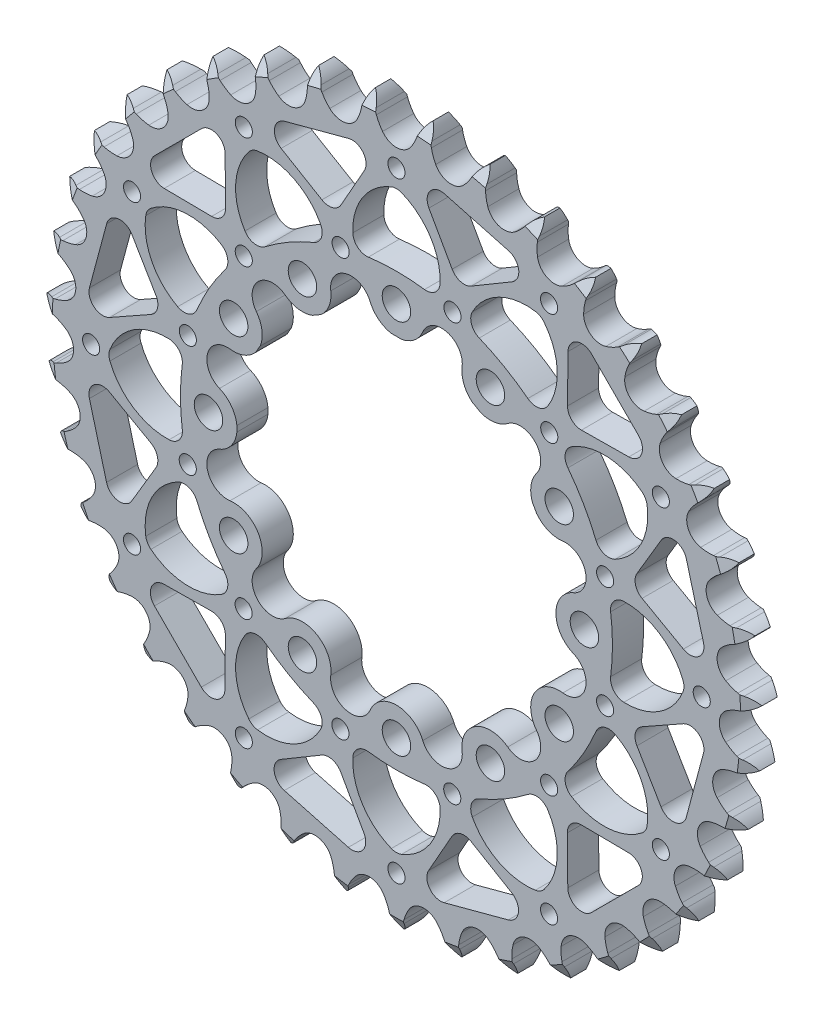
from build123d import *

# Parameters (mm, degrees)
EXTRUSION_DEPTH          = 7.2136
CIRPATTERN1_COUNT        = 12
CUT_EXTRUDE1_DEPTH       = 118.514389318
CUT_EXTRUDE1_DEPTH_BACK  = 118.514389318
SKETCH8_R                = 37
CENTER_CUTOUT_DEPTH      = 118.514389465
CENTER_CUTOUT_DEPTH_BACK = 118.514389465
SKETCH10_R               = 1.984375
CUT_EXTRUDE2_DEPTH       = 118.514389465


with BuildPart() as part:
    # Teeth Sketch → Extrusion (new body)
    with BuildSketch(Plane.XY):
        with BuildLine():
            ThreePointArc((6.676484762, 82.703103732), (5.710873677, 81.555589606), (5.037571935, 80.215493266))
            Line((5.037571935, 80.215493266), (4.65053543, 79.150636707))
            ThreePointArc((4.65053543, 79.150636707), (4.030589042, 77.787636082), (3.22092759, 76.5280518))
            ThreePointArc((3.22092759, 76.5280518), (0, 74.905926143), (-3.22092759, 76.5280518))
            ThreePointArc((-3.22092759, 76.5280518), (-4.030589042, 77.787636082), (-4.65053543, 79.150636707))
            Line((-4.65053543, 79.150636707), (-5.037571935, 80.215493266))
            ThreePointArc((-5.037571935, 80.215493266), (-5.710873677, 81.555589606), (-6.676484762, 82.703103732))
            ThreePointArc((-6.676484762, 82.703103732), (-7.445517227, 81.415554702), (-7.895133318, 79.984807062))
            Line((-7.895133318, 79.984807062), (-8.106342797, 78.871655094))
            ThreePointArc((-8.106342797, 78.871655094), (-8.499620367, 77.426858575), (-9.096745387, 76.053706749))
            ThreePointArc((-9.096745387, 76.053706749), (-12.015755556, 73.935914073), (-15.455180235, 75.020360508))
            ThreePointArc((-15.455180235, 75.020360508), (-16.456408311, 76.133754674), (-17.286967233, 77.379658404))
            Line((-17.286967233, 77.379658404), (-17.83980672, 78.368640329))
            ThreePointArc((-17.83980672, 78.368640329), (-18.719355953, 79.583377579), (-19.856536839, 80.561136787))
            ThreePointArc((-19.856536839, 80.561136787), (-20.409073146, 79.166899696), (-20.623358765, 77.682556369))
            Line((-20.623358765, 77.682556369), (-20.653271004, 76.549939044))
            ThreePointArc((-20.653271004, 76.549939044), (-20.809694072, 75.060766102), (-21.178817437, 73.609610642))
            ThreePointArc((-21.178817437, 73.609610642), (-23.720309356, 71.051000665), (-27.289151829, 71.569681286))
            ThreePointArc((-27.289151829, 71.569681286), (-28.456015249, 72.508049011), (-29.475675664, 73.604587595))
            Line((-29.475675664, 73.604587595), (-30.179999883, 74.492080773))
            ThreePointArc((-30.179999883, 74.492080773), (-31.243016742, 75.549997876), (-32.522315041, 76.332678717))
            ThreePointArc((-32.522315041, 76.332678717), (-32.844044791, 74.867863573), (-32.817450053, 73.368368272))
            Line((-32.817450053, 73.368368272), (-32.66529034, 72.245619783))
            ThreePointArc((-32.66529034, 72.245619783), (-32.580807632, 70.750639215), (-32.71236924, 69.259064285))
            ThreePointArc((-32.71236924, 69.259064285), (-34.810519602, 66.325903661), (-38.416348726, 66.265384911))
            ThreePointArc((-38.416348726, 66.265384911), (-39.71862634, 67.004422965), (-40.900979579, 67.923196629))
            Line((-40.900979579, 67.923196629), (-41.738546902, 68.686215454))
            ThreePointArc((-41.738546902, 68.686215454), (-42.957499809, 69.559912912), (-44.345782367, 70.127244363))
            ThreePointArc((-44.345782367, 70.127244363), (-44.428372928, 68.629789109), (-44.161586623, 67.153977974))
            Line((-44.161586623, 67.153977974), (-43.831295815, 66.070176918))
            ThreePointArc((-43.831295815, 66.070176918), (-43.508095388, 64.608107935), (-43.398687863, 63.114744543))
            ThreePointArc((-43.398687863, 63.114744543), (-44.999155676, 59.883000591), (-48.54858237, 59.244849876))
            ThreePointArc((-48.54858237, 59.244849876), (-49.952545871, 59.765417561), (-51.266969607, 60.48263055))
            Line((-51.266969607, 60.48263055), (-52.21608748, 61.101413234))
            ThreePointArc((-52.21608748, 61.101413234), (-53.559406195, 61.768262742), (-55.020717224, 62.105551216))
            ThreePointArc((-55.020717224, 62.105551216), (-54.862029543, 60.614239157), (-54.361961296, 59.200334922))
            Line((-54.361961296, 59.200334922), (-53.862093752, 58.183551176))
            ThreePointArc((-53.862093752, 58.183551176), (-53.308546327, 56.792260597), (-52.961003266, 55.335786069))
            ThreePointArc((-52.961003266, 55.335786069), (-54.022337255, 51.889159262), (-57.423433231, 50.689904348))
            ThreePointArc((-57.423433231, 50.689904348), (-58.892720703, 50.978519235), (-60.305172051, 51.475596109))
            Line((-60.305172051, 51.475596109), (-61.34125882, 51.934116506))
            ThreePointArc((-61.34125882, 51.934116506), (-62.774152094, 52.376847013), (-64.270644405, 52.475356916))
            ThreePointArc((-64.270644405, 52.475356916), (-63.87478841, 51.02881225), (-63.154389727, 49.713434291))
            Line((-63.154389727, 49.713434291), (-62.497891753, 48.790002021))
            ThreePointArc((-62.497891753, 48.790002021), (-61.728333918, 47.505523541), (-61.151656504, 46.123659804))
            ThreePointArc((-61.151656504, 46.123659804), (-61.646368676, 42.551415963), (-64.811047336, 40.822116924))
            ThreePointArc((-64.811047336, 40.822116924), (-66.307605004, 40.871304038), (-67.781502216, 41.135370767))
            Line((-67.781502216, 41.135370767), (-68.877723777, 41.42175344))
            ThreePointArc((-68.877723777, 41.42175344), (-70.363080428, 41.628898458), (-71.855995657, 41.486078435))
            ThreePointArc((-71.855995657, 41.486078435), (-71.23322381, 40.12176591), (-70.311152637, 38.938981826))
            Line((-70.311152637, 38.938981826), (-69.515027187, 38.132817442))
            ThreePointArc((-69.515027187, 38.132817442), (-68.549390085, 36.988418379), (-67.75851396, 35.716954977))
            ThreePointArc((-67.75851396, 35.716954977), (-67.673791529, 32.111613343), (-70.520089358, 29.897058114))
            ThreePointArc((-70.520089358, 29.897058114), (-72.005157166, 29.705543536), (-73.502327078, 29.729760931))
            Line((-73.502327078, 29.729760931), (-74.630291869, 29.836588719))
            ThreePointArc((-74.630291869, 29.836588719), (-76.129641939, 29.8027833), (-77.580314364, 29.422332315))
            ThreePointArc((-77.580314364, 29.422332315), (-76.74675613, 28.175586908), (-75.646893627, 27.156030185))
            Line((-75.646893627, 27.156030185), (-74.731759931, 26.488012922))
            ThreePointArc((-74.731759931, 26.488012922), (-73.595053056, 25.51333261), (-72.610461496, 24.385199777))
            ThreePointArc((-72.610461496, 24.385199777), (-71.948498729, 20.840136804), (-74.402698108, 18.197681204))
            ThreePointArc((-74.402698108, 18.197681204), (-75.837813579, 17.77042506), (-77.319480277, 17.554165902))
            Line((-77.319480277, 17.554165902), (-78.449974603, 17.478672021))
            ThreePointArc((-78.449974603, 17.478672021), (-79.924485713, 17.204791709), (-81.295343681, 16.596563242))
            ThreePointArc((-81.295343681, 16.596563242), (-80.27258778, 15.499675005), (-79.023419807, 14.669751627))
            Line((-79.023419807, 14.669751627), (-78.012979347, 14.15718278))
            ThreePointArc((-78.012979347, 14.15718278), (-76.734642811, 13.377464928), (-75.58183622, 12.421880712))
            ThreePointArc((-75.58183622, 12.421880712), (-74.359777605, 9.028911669), (-76.358316059, 6.026993909))
            ThreePointArc((-76.358316059, 6.026993909), (-77.706310456, 5.375061909), (-79.134099551, 4.923927198))
            Line((-79.134099551, 4.923927198), (-80.237844202, 4.6680669))
            ThreePointArc((-80.237844202, 4.6680669), (-81.649327289, 4.161205049), (-82.904866299, 3.340951899))
            ThreePointArc((-82.904866299, 3.340951899), (-81.719401571, 2.422329661), (-80.353280924, 1.803534207))
            Line((-80.353280924, 1.803534207), (-79.273703577, 1.45968904))
            ThreePointArc((-79.273703577, 1.45968904), (-77.886845624, 0.895127931), (-76.595681088, 0.136841462))
            ThreePointArc((-76.595681088, 0.136841462), (-74.8451773, -3.016157536), (-76.336293733, -6.299789363))
            ThreePointArc((-76.336293733, -6.299789363), (-77.56225471, -7.159512522), (-78.899187214, -7.833838635))
            Line((-78.899187214, -7.833838635), (-79.947595784, -8.263438702))
            ThreePointArc((-79.947595784, -8.263438702), (-81.259494176, -8.990154635), (-82.367196428, -10.001188343))
            ThreePointArc((-82.367196428, -10.001188343), (-81.049725787, -10.717752749), (-79.602034272, -11.109393802))
            Line((-79.602034272, -11.109393802), (-78.481280524, -11.275609878))
            ThreePointArc((-78.481280524, -11.275609878), (-77.021820047, -11.610392409), (-75.625738049, -12.151741911))
            ThreePointArc((-75.625738049, -12.151741911), (-73.392126218, -14.983109845), (-74.337201497, -18.463411399))
            ThreePointArc((-74.337201497, -18.463411399), (-75.409377308, -19.50865934), (-76.620827372, -20.388712162))
            Line((-76.620827372, -20.388712162), (-77.586746629, -20.980925582))
            ThreePointArc((-77.586746629, -20.980925582), (-78.765082849, -21.908674036), (-79.696259435, -23.08430306))
            ThreePointArc((-79.696259435, -23.08430306), (-78.280904679, -23.580250992), (-76.789136745, -23.734594346))
            Line((-76.789136745, -23.734594346), (-75.656233531, -23.718876424))
            ThreePointArc((-75.656233531, -23.718876424), (-74.161969788, -23.815209685), (-72.697128119, -24.125601551))
            ThreePointArc((-72.697128119, -24.125601551), (-70.038257617, -26.562007479), (-70.41281479, -30.148840778))
            ThreePointArc((-70.41281479, -30.148840778), (-71.303436645, -31.352542128), (-72.358028349, -32.415528753))
            Line((-72.358028349, -32.415528753), (-73.216441492, -33.155017511))
            ThreePointArc((-73.216441492, -33.155017511), (-74.230697248, -34.259770288), (-74.961231185, -35.569546454))
            ThreePointArc((-74.961231185, -35.569546454), (-73.484649258, -35.832033121), (-71.987440912, -35.745081364))
            Line((-71.987440912, -35.745081364), (-70.871729829, -35.547836529))
            ThreePointArc((-70.871729829, -35.547836529), (-69.381363468, -35.403225539), (-67.885700756, -35.474620783))
            ThreePointArc((-67.885700756, -35.474620783), (-64.870434934, -37.452963072), (-64.664773166, -41.053431017))
            ThreePointArc((-64.664773166, -41.053431017), (-65.350774426, -42.384410543), (-66.221194398, -43.602800177))
            Line((-66.221194398, -43.602800177), (-66.949868978, -44.470411902))
            ThreePointArc((-66.949868978, -44.470411902), (-67.773775581, -45.723556485), (-68.284746423, -47.133557278))
            ThreePointArc((-68.284746423, -47.133557278), (-66.785180021, -47.155784414), (-65.321308173, -46.829789551))
            Line((-65.321308173, -46.829789551), (-64.251685552, -46.456126341))
            ThreePointArc((-64.251685552, -46.456126341), (-62.803816278, -46.074316448), (-61.316069403, -45.904865971))
            ThreePointArc((-61.316069403, -45.904865971), (-58.022502061, -47.373906594), (-57.241947884, -50.894758957))
            ThreePointArc((-57.241947884, -50.894758957), (-57.705561477, -52.318544989), (-58.369266298, -53.66078198))
            Line((-58.369266298, -53.66078198), (-58.949330025, -54.634045983))
            ThreePointArc((-58.949330025, -54.634045983), (-59.561548726, -56.003126587), (-59.839722596, -57.476833727))
            ThreePointArc((-59.839722596, -57.476833727), (-58.356009703, -57.25822566), (-56.963387864, -56.701630787))
            Line((-56.963387864, -56.701630787), (-55.967556369, -56.161226883))
            ThreePointArc((-55.967556369, -56.161226883), (-54.599683236, -55.552106762), (-53.15838406, -55.146199243))
            ThreePointArc((-53.15838406, -55.146199243), (-49.671816862, -56.06789082), (-48.336586219, -59.417939375))
            ThreePointArc((-48.336586219, -59.417939375), (-48.565804798, -60.897656602), (-49.00560486, -62.328977716))
            Line((-49.00560486, -62.328977716), (-49.422034389, -63.382686971))
            ThreePointArc((-49.422034389, -63.382686971), (-49.806709045, -64.832245127), (-49.844881387, -66.331490374))
            ThreePointArc((-49.844881387, -66.331490374), (-48.415449386, -65.877708938), (-47.130145731, -65.104929569))
            Line((-47.130145731, -65.104929569), (-46.233896874, -64.411781148))
            ThreePointArc((-46.233896874, -64.411781148), (-44.981447078, -63.591126692), (-43.623924493, -62.959274922))
            ThreePointArc((-43.623924493, -62.959274922), (-40.034657698, -63.309746125), (-38.179332362, -66.402226373))
            ThreePointArc((-38.179332362, -66.402226373), (-38.168219284, -67.899550896), (-38.372723998, -69.38288567))
            Line((-38.372723998, -69.38288567), (-38.614734022, -70.489749661))
            ThreePointArc((-38.614734022, -70.489749661), (-38.761901763, -71.982242573), (-38.559083932, -73.468196262))
            ThreePointArc((-38.559083932, -73.468196262), (-37.220954361, -72.790994159), (-36.076257579, -71.822044874))
            Line((-36.076257579, -71.822044874), (-35.302803736, -70.994104116))
            ThreePointArc((-35.302803736, -70.994104116), (-34.198215068, -69.983169844), (-32.959628196, -69.141738451))
            ThreePointArc((-32.959628196, -69.141738451), (-29.360621929, -68.91191226), (-27.033253851, -71.666730588))
            ThreePointArc((-27.033253851, -71.666730588), (-26.78209694, -73.142882488), (-26.74600974, -74.639813329))
            Line((-26.74600974, -74.639813329), (-26.807332328, -75.77116486))
            ThreePointArc((-26.807332328, -75.77116486), (-26.713181585, -77.267937748), (-26.274626458, -78.702114459))
            ThreePointArc((-26.274626458, -78.702114459), (-25.06245617, -77.819030866), (-24.088013307, -76.679006943))
            Line((-24.088013307, -76.679006943), (-23.457386525, -75.737717079))
            ThreePointArc((-23.457386525, -75.737717079), (-22.529267252, -74.562685657), (-21.441694841, -73.533467273))
            ThreePointArc((-21.441694841, -73.533467273), (-17.926161474, -72.729296065), (-15.187028265, -75.075104125))
            ThreePointArc((-15.187028265, -75.075104125), (-14.702332353, -76.491851845), (-14.426587879, -77.96360903))
            Line((-14.426587879, -77.96360903), (-14.305634807, -79.090146691))
            ThreePointArc((-14.305634807, -79.090146691), (-13.972604036, -80.552433921), (-13.309669959, -81.897689231))
            ThreePointArc((-13.309669959, -81.897689231), (-12.254853529, -80.83159555), (-11.475902142, -79.55002301))
            Line((-11.475902142, -79.55002301), (-11.004435324, -78.519762952))
            ThreePointArc((-11.004435324, -78.519762952), (-10.276823247, -77.211067077), (-9.368432854, -76.020717918))
            ThreePointArc((-9.368432854, -76.020717918), (-6.027422853, -74.663029306), (-2.947466624, -76.5390719))
            ThreePointArc((-2.947466624, -76.5390719), (-2.241785081, -77.859722417), (-1.733524971, -79.26818821))
            Line((-1.733524971, -79.26818821), (-1.43342886, -80.360735266))
            ThreePointArc((-1.43342886, -80.360735266), (-0.870143382, -81.750664368), (0, -82.97215687))
            ThreePointArc((0, -82.97215687), (0.870143382, -81.750664368), (1.43342886, -80.360735266))
            Line((1.43342886, -80.360735266), (1.733524971, -79.26818821))
            ThreePointArc((1.733524971, -79.26818821), (2.241785081, -77.859722417), (2.947466624, -76.5390719))
            ThreePointArc((2.947466624, -76.5390719), (6.027422853, -74.663029306), (9.368432854, -76.020717918))
            ThreePointArc((9.368432854, -76.020717918), (10.276823247, -77.211067077), (11.004435324, -78.519762952))
            Line((11.004435324, -78.519762952), (11.475902142, -79.55002301))
            ThreePointArc((11.475902142, -79.55002301), (12.254853529, -80.83159555), (13.309669959, -81.897689231))
            ThreePointArc((13.309669959, -81.897689231), (13.972604036, -80.552433921), (14.305634807, -79.090146691))
            Line((14.305634807, -79.090146691), (14.426587879, -77.96360903))
            ThreePointArc((14.426587879, -77.96360903), (14.702332353, -76.491851845), (15.187028265, -75.075104125))
            ThreePointArc((15.187028265, -75.075104125), (17.926161474, -72.729296065), (21.441694841, -73.533467273))
            ThreePointArc((21.441694841, -73.533467273), (22.529267252, -74.562685657), (23.457386525, -75.737717079))
            Line((23.457386525, -75.737717079), (24.088013307, -76.679006943))
            ThreePointArc((24.088013307, -76.679006943), (25.06245617, -77.819030866), (26.274626458, -78.702114459))
            ThreePointArc((26.274626458, -78.702114459), (26.713181585, -77.267937748), (26.807332328, -75.77116486))
            Line((26.807332328, -75.77116486), (26.74600974, -74.639813329))
            ThreePointArc((26.74600974, -74.639813329), (26.78209694, -73.142882488), (27.033253851, -71.666730588))
            ThreePointArc((27.033253851, -71.666730588), (29.360621929, -68.91191226), (32.959628196, -69.141738451))
            ThreePointArc((32.959628196, -69.141738451), (34.198215068, -69.983169844), (35.302803736, -70.994104116))
            Line((35.302803736, -70.994104116), (36.076257579, -71.822044874))
            ThreePointArc((36.076257579, -71.822044874), (37.220954361, -72.790994159), (38.559083932, -73.468196262))
            ThreePointArc((38.559083932, -73.468196262), (38.761901763, -71.982242573), (38.614734022, -70.489749661))
            Line((38.614734022, -70.489749661), (38.372723998, -69.38288567))
            ThreePointArc((38.372723998, -69.38288567), (38.168219284, -67.899550896), (38.179332362, -66.402226373))
            ThreePointArc((38.179332362, -66.402226373), (40.034657698, -63.309746125), (43.623924493, -62.959274922))
            ThreePointArc((43.623924493, -62.959274922), (44.981447078, -63.591126692), (46.233896874, -64.411781148))
            Line((46.233896874, -64.411781148), (47.130145731, -65.104929569))
            ThreePointArc((47.130145731, -65.104929569), (48.415449386, -65.877708938), (49.844881387, -66.331490374))
            ThreePointArc((49.844881387, -66.331490374), (49.806709045, -64.832245127), (49.422034389, -63.382686971))
            Line((49.422034389, -63.382686971), (49.00560486, -62.328977716))
            ThreePointArc((49.00560486, -62.328977716), (48.565804798, -60.897656602), (48.336586219, -59.417939375))
            ThreePointArc((48.336586219, -59.417939375), (49.671816862, -56.06789082), (53.15838406, -55.146199243))
            ThreePointArc((53.15838406, -55.146199243), (54.599683236, -55.552106762), (55.967556369, -56.161226883))
            Line((55.967556369, -56.161226883), (56.963387864, -56.701630787))
            ThreePointArc((56.963387864, -56.701630787), (58.356009703, -57.25822566), (59.839722596, -57.476833727))
            ThreePointArc((59.839722596, -57.476833727), (59.561548726, -56.003126587), (58.949330025, -54.634045983))
            Line((58.949330025, -54.634045983), (58.369266298, -53.66078198))
            ThreePointArc((58.369266298, -53.66078198), (57.705561477, -52.318544989), (57.241947884, -50.894758957))
            ThreePointArc((57.241947884, -50.894758957), (58.022502061, -47.373906594), (61.316069403, -45.904865971))
            ThreePointArc((61.316069403, -45.904865971), (62.803816278, -46.074316448), (64.251685552, -46.456126341))
            Line((64.251685552, -46.456126341), (65.321308173, -46.829789551))
            ThreePointArc((65.321308173, -46.829789551), (66.785180021, -47.155784414), (68.284746423, -47.133557278))
            ThreePointArc((68.284746423, -47.133557278), (67.773775581, -45.723556485), (66.949868978, -44.470411902))
            Line((66.949868978, -44.470411902), (66.221194398, -43.602800177))
            ThreePointArc((66.221194398, -43.602800177), (65.350774426, -42.384410543), (64.664773166, -41.053431017))
            ThreePointArc((64.664773166, -41.053431017), (64.870434934, -37.452963072), (67.885700756, -35.474620783))
            ThreePointArc((67.885700756, -35.474620783), (69.381363468, -35.403225539), (70.871729829, -35.547836529))
            Line((70.871729829, -35.547836529), (71.987440912, -35.745081364))
            ThreePointArc((71.987440912, -35.745081364), (73.484649258, -35.832033121), (74.961231185, -35.569546454))
            ThreePointArc((74.961231185, -35.569546454), (74.230697248, -34.259770288), (73.216441492, -33.155017511))
            Line((73.216441492, -33.155017511), (72.358028349, -32.415528753))
            ThreePointArc((72.358028349, -32.415528753), (71.303436645, -31.352542128), (70.41281479, -30.148840778))
            ThreePointArc((70.41281479, -30.148840778), (70.038257617, -26.562007479), (72.697128119, -24.125601551))
            ThreePointArc((72.697128119, -24.125601551), (74.161969788, -23.815209685), (75.656233531, -23.718876424))
            Line((75.656233531, -23.718876424), (76.789136745, -23.734594346))
            ThreePointArc((76.789136745, -23.734594346), (78.280904679, -23.580250992), (79.696259435, -23.08430306))
            ThreePointArc((79.696259435, -23.08430306), (78.765082849, -21.908674036), (77.586746629, -20.980925582))
            Line((77.586746629, -20.980925582), (76.620827372, -20.388712162))
            ThreePointArc((76.620827372, -20.388712162), (75.409377308, -19.50865934), (74.337201497, -18.463411399))
            ThreePointArc((74.337201497, -18.463411399), (73.392126218, -14.983109845), (75.625738049, -12.151741911))
            ThreePointArc((75.625738049, -12.151741911), (77.021820047, -11.610392409), (78.481280524, -11.275609878))
            Line((78.481280524, -11.275609878), (79.602034272, -11.109393802))
            ThreePointArc((79.602034272, -11.109393802), (81.049725787, -10.717752749), (82.367196428, -10.001188343))
            ThreePointArc((82.367196428, -10.001188343), (81.259494176, -8.990154635), (79.947595784, -8.263438702))
            Line((79.947595784, -8.263438702), (78.899187214, -7.833838635))
            ThreePointArc((78.899187214, -7.833838635), (77.56225471, -7.159512522), (76.336293733, -6.299789363))
            ThreePointArc((76.336293733, -6.299789363), (74.8451773, -3.016157536), (76.595681088, 0.136841462))
            ThreePointArc((76.595681088, 0.136841462), (77.886845624, 0.895127931), (79.273703577, 1.45968904))
            Line((79.273703577, 1.45968904), (80.353280924, 1.803534207))
            ThreePointArc((80.353280924, 1.803534207), (81.719401571, 2.422329661), (82.904866299, 3.340951899))
            ThreePointArc((82.904866299, 3.340951899), (81.649327289, 4.161205049), (80.237844202, 4.6680669))
            Line((80.237844202, 4.6680669), (79.134099551, 4.923927198))
            ThreePointArc((79.134099551, 4.923927198), (77.706310456, 5.375061909), (76.358316059, 6.026993909))
            ThreePointArc((76.358316059, 6.026993909), (74.359777605, 9.028911669), (75.58183622, 12.421880712))
            ThreePointArc((75.58183622, 12.421880712), (76.734642811, 13.377464928), (78.012979347, 14.15718278))
            Line((78.012979347, 14.15718278), (79.023419807, 14.669751627))
            ThreePointArc((79.023419807, 14.669751627), (80.27258778, 15.499675005), (81.295343681, 16.596563242))
            ThreePointArc((81.295343681, 16.596563242), (79.924485713, 17.204791709), (78.449974603, 17.478672021))
            Line((78.449974603, 17.478672021), (77.319480277, 17.554165902))
            ThreePointArc((77.319480277, 17.554165902), (75.837813579, 17.77042506), (74.402698108, 18.197681204))
            ThreePointArc((74.402698108, 18.197681204), (71.948498729, 20.840136804), (72.610461496, 24.385199777))
            ThreePointArc((72.610461496, 24.385199777), (73.595053056, 25.51333261), (74.731759931, 26.488012922))
            Line((74.731759931, 26.488012922), (75.646893627, 27.156030185))
            ThreePointArc((75.646893627, 27.156030185), (76.74675613, 28.175586908), (77.580314364, 29.422332315))
            ThreePointArc((77.580314364, 29.422332315), (76.129641939, 29.8027833), (74.630291869, 29.836588719))
            Line((74.630291869, 29.836588719), (73.502327078, 29.729760931))
            ThreePointArc((73.502327078, 29.729760931), (72.005157166, 29.705543536), (70.520089358, 29.897058114))
            ThreePointArc((70.520089358, 29.897058114), (67.673791529, 32.111613343), (67.75851396, 35.716954977))
            ThreePointArc((67.75851396, 35.716954977), (68.549390085, 36.988418379), (69.515027187, 38.132817442))
            Line((69.515027187, 38.132817442), (70.311152637, 38.938981826))
            ThreePointArc((70.311152637, 38.938981826), (71.23322381, 40.12176591), (71.855995657, 41.486078435))
            ThreePointArc((71.855995657, 41.486078435), (70.363080428, 41.628898458), (68.877723777, 41.42175344))
            Line((68.877723777, 41.42175344), (67.781502216, 41.135370767))
            ThreePointArc((67.781502216, 41.135370767), (66.307605004, 40.871304038), (64.811047336, 40.822116924))
            ThreePointArc((64.811047336, 40.822116924), (61.646368676, 42.551415963), (61.151656504, 46.123659804))
            ThreePointArc((61.151656504, 46.123659804), (61.728333918, 47.505523541), (62.497891753, 48.790002021))
            Line((62.497891753, 48.790002021), (63.154389727, 49.713434291))
            ThreePointArc((63.154389727, 49.713434291), (63.87478841, 51.02881225), (64.270644405, 52.475356916))
            ThreePointArc((64.270644405, 52.475356916), (62.774152094, 52.376847013), (61.34125882, 51.934116506))
            Line((61.34125882, 51.934116506), (60.305172051, 51.475596109))
            ThreePointArc((60.305172051, 51.475596109), (58.892720703, 50.978519235), (57.423433231, 50.689904348))
            ThreePointArc((57.423433231, 50.689904348), (54.022337255, 51.889159262), (52.961003266, 55.335786069))
            ThreePointArc((52.961003266, 55.335786069), (53.308546327, 56.792260597), (53.862093752, 58.183551176))
            Line((53.862093752, 58.183551176), (54.361961296, 59.200334922))
            ThreePointArc((54.361961296, 59.200334922), (54.862029543, 60.614239157), (55.020717224, 62.105551216))
            ThreePointArc((55.020717224, 62.105551216), (53.559406195, 61.768262742), (52.21608748, 61.101413234))
            Line((52.21608748, 61.101413234), (51.266969607, 60.48263055))
            ThreePointArc((51.266969607, 60.48263055), (49.952545871, 59.765417561), (48.54858237, 59.244849876))
            ThreePointArc((48.54858237, 59.244849876), (44.999155676, 59.883000591), (43.398687863, 63.114744543))
            ThreePointArc((43.398687863, 63.114744543), (43.508095388, 64.608107935), (43.831295815, 66.070176918))
            Line((43.831295815, 66.070176918), (44.161586623, 67.153977974))
            ThreePointArc((44.161586623, 67.153977974), (44.428372928, 68.629789109), (44.345782367, 70.127244363))
            ThreePointArc((44.345782367, 70.127244363), (42.957499809, 69.559912912), (41.738546902, 68.686215454))
            Line((41.738546902, 68.686215454), (40.900979579, 67.923196629))
            ThreePointArc((40.900979579, 67.923196629), (39.71862634, 67.004422965), (38.416348726, 66.265384911))
            ThreePointArc((38.416348726, 66.265384911), (34.810519602, 66.325903661), (32.71236924, 69.259064285))
            ThreePointArc((32.71236924, 69.259064285), (32.580807632, 70.750639215), (32.66529034, 72.245619783))
            Line((32.66529034, 72.245619783), (32.817450053, 73.368368272))
            ThreePointArc((32.817450053, 73.368368272), (32.844044791, 74.867863573), (32.522315041, 76.332678717))
            ThreePointArc((32.522315041, 76.332678717), (31.243016742, 75.549997876), (30.179999883, 74.492080773))
            Line((30.179999883, 74.492080773), (29.475675664, 73.604587595))
            ThreePointArc((29.475675664, 73.604587595), (28.456015249, 72.508049011), (27.289151829, 71.569681286))
            ThreePointArc((27.289151829, 71.569681286), (23.720309356, 71.051000665), (21.178817437, 73.609610642))
            ThreePointArc((21.178817437, 73.609610642), (20.809694072, 75.060766102), (20.653271004, 76.549939044))
            Line((20.653271004, 76.549939044), (20.623358765, 77.682556369))
            ThreePointArc((20.623358765, 77.682556369), (20.409073146, 79.166899696), (19.856536839, 80.561136787))
            ThreePointArc((19.856536839, 80.561136787), (18.719355953, 79.583377579), (17.83980672, 78.368640329))
            Line((17.83980672, 78.368640329), (17.286967233, 77.379658404))
            ThreePointArc((17.286967233, 77.379658404), (16.456408311, 76.133754674), (15.455180235, 75.020360508))
            ThreePointArc((15.455180235, 75.020360508), (12.015755556, 73.935914073), (9.096745387, 76.053706749))
            ThreePointArc((9.096745387, 76.053706749), (8.499620367, 77.426858575), (8.106342797, 78.871655094))
            Line((8.106342797, 78.871655094), (7.895133318, 79.984807062))
            ThreePointArc((7.895133318, 79.984807062), (7.445517227, 81.415554702), (6.676484762, 82.703103732))
        make_face()
    extrude(amount=EXTRUSION_DEPTH)

    # Sketch7 → M6 Clearance Hole1 (revolve, cut)
    with BuildSketch(Plane(origin=(0, 43.500000122, 0), x_dir=(0, 1, 0), z_dir=(1, 0, 0))):
        Polygon((0, 0), (0, 19.254840043), (3.3, 17.272), (3.3, 0), align=None)
    m6_clearance_hole1 = revolve(axis=Axis((0, 43.500000122, -6.35), (0, 0, 1)), mode=Mode.SUBTRACT)

    # CirPattern1: M6 Clearance Hole1 ×12 about axis
    cirpattern1_axis = Axis((0, -0.078817912, 0), (0, 0, 1))
    for i in range(1, CIRPATTERN1_COUNT):
        add(m6_clearance_hole1.rotate(cirpattern1_axis, i * 360 / CIRPATTERN1_COUNT), mode=Mode.SUBTRACT)

    # Sketch8 → Cut-Extrude1 (cut, two sides: drawn at the far end of the back side and taken through both)
    with BuildSketch(Plane(origin=(0, 0, 0), x_dir=(-1, 0, 0), z_dir=(0, 0, -1)).offset(-CUT_EXTRUDE1_DEPTH_BACK)):
        Circle(SKETCH8_R)
    extrude(amount=CUT_EXTRUDE1_DEPTH + CUT_EXTRUDE1_DEPTH_BACK, mode=Mode.SUBTRACT)

    # Sketch5 → Cut-Revolve1 (revolve, cut)
    with BuildSketch(Plane(origin=(0, 0, 0), x_dir=(0, 0, -1), z_dir=(1, 0, 0))):
        Polygon((-7.2136, -79.778574738), (-7.2136, -82.97215687), (-5.3848, -82.97215687), align=None)
    cut_revolve1 = revolve(axis=Axis((0, 0, 7.2136), (0, 0, -1)), mode=Mode.SUBTRACT)

    # Mirror1: Cut-Revolve1 across plane
    add(cut_revolve1.mirror(Plane.XY.offset(3.6068)), mode=Mode.SUBTRACT)

    # Sketch9 → Center Cutout (cut, two sides: drawn at the far end of the back side and taken through both)
    with BuildSketch(Plane.XY.offset(7.2136).offset(-CENTER_CUTOUT_DEPTH_BACK)):
        with BuildLine():
            ThreePointArc((1.148678559, 36.982165128), (0, 36.881719723), (-1.148678559, 36.982165128))
            ThreePointArc((-1.148678559, 36.982165128), (-9.617726785, 35.728130814), (-17.571834052, 32.561183149))
            ThreePointArc((-17.571834052, 32.561183149), (-18.475078878, 31.932946165), (-19.469920872, 31.463028799))
            ThreePointArc((-19.469920872, 31.463028799), (-22.757183287, 31.114405097), (-25.803005362, 32.399162099))
            ThreePointArc((-25.803005362, 32.399162099), (-32.058776499, 31.979958587), (-32.477980012, 25.72418745))
            ThreePointArc((-32.477980012, 25.72418745), (-31.470213373, 23.82881041), (-31.122083086, 21.710591105))
            ThreePointArc((-31.122083086, 21.710591105), (-31.241007029, 20.461591061), (-31.59350497, 19.257477605))
            ThreePointArc((-31.59350497, 19.257477605), (-32.00358372, 18.410440597), (-32.529655862, 17.630130162))
            ThreePointArc((-32.529655862, 17.630130162), (-35.22884515, 15.587363925), (-38.585048144, 15.14643516))
            ThreePointArc((-38.585048144, 15.14643516), (-43.793103112, 11.655508701), (-41.028258435, 6.02825022))
            ThreePointArc((-41.028258435, 6.02825022), (-38.265449818, 3.867034802), (-36.99517654, 0.597421776))
            ThreePointArc((-36.99517654, 0.597421776), (-36.969203034, 0.259745217), (-36.960537635, -0.078817912))
            ThreePointArc((-36.960537635, -0.078817912), (-36.968601511, -0.405426166), (-36.992773486, -0.731238524))
            ThreePointArc((-36.992773486, -0.731238524), (-38.258321936, -4.015054276), (-41.028258435, -6.185886044))
            ThreePointArc((-41.028258435, -6.185886044), (-43.793103112, -11.813144525), (-38.585048144, -15.304070984))
            ThreePointArc((-38.585048144, -15.304070984), (-33.369363855, -16.898720145), (-31.122083086, -21.868226929))
            ThreePointArc((-31.122083086, -21.868226929), (-31.470213373, -23.986446234), (-32.477980012, -25.881823274))
            ThreePointArc((-32.477980012, -25.881823274), (-32.058776499, -32.137594411), (-25.803005362, -32.556797924))
            ThreePointArc((-25.803005362, -32.556797924), (-18.853550589, -31.887708499), (-15.171128618, -37.819181396))
            ThreePointArc((-15.171128618, -37.819181396), (-15.184673592, -38.242389865), (-15.225253072, -38.663866056))
            ThreePointArc((-15.225253072, -38.663866056), (-11.734326613, -43.871921024), (-6.107068132, -41.107076347))
            ThreePointArc((-6.107068132, -41.107076347), (0, -37.039355547), (6.107068132, -41.107076347))
            ThreePointArc((6.107068132, -41.107076347), (11.734326613, -43.871921024), (15.225253072, -38.663866056))
            ThreePointArc((15.225253072, -38.663866056), (18.480268818, -32.087582442), (25.803005362, -32.556797924))
            ThreePointArc((25.803005362, -32.556797924), (32.058776499, -32.137594411), (32.477980012, -25.881823274))
            ThreePointArc((32.477980012, -25.881823274), (31.135298942, -22.286267386), (32.013950026, -18.550121394))
            ThreePointArc((32.013950026, -18.550121394), (35.635096733, -9.956901166), (36.992773486, -0.731238524))
            ThreePointArc((36.992773486, -0.731238524), (36.96054846, -0.066847918), (36.99517654, 0.597421776))
            ThreePointArc((36.99517654, 0.597421776), (35.79041588, 9.383289996), (32.529655862, 17.630130162))
            ThreePointArc((32.529655862, 17.630130162), (32.00358372, 18.410440597), (31.59350497, 19.257477605))
            ThreePointArc((31.59350497, 19.257477605), (31.183132, 22.607447115), (32.477980012, 25.72418745))
            ThreePointArc((32.477980012, 25.72418745), (32.058776499, 31.979958587), (25.803005362, 32.399162099))
            ThreePointArc((25.803005362, 32.399162099), (22.757183287, 31.114405097), (19.469920872, 31.463028799))
            ThreePointArc((19.469920872, 31.463028799), (18.475078878, 31.932946165), (17.571834052, 32.561183149))
            ThreePointArc((17.571834052, 32.561183149), (9.617726785, 35.728130814), (1.148678559, 36.982165128))
        make_face()
        with BuildLine():
            ThreePointArc((41.028258435, -6.185886044), (38.258321936, -4.015054276), (36.992773486, -0.731238524))
            ThreePointArc((36.992773486, -0.731238524), (35.635096733, -9.956901166), (32.013950026, -18.550121394))
            ThreePointArc((32.013950026, -18.550121394), (34.809147042, -15.934458682), (38.585048144, -15.304070984))
            ThreePointArc((38.585048144, -15.304070984), (43.793103112, -11.813144525), (41.028258435, -6.185886044))
        make_face()
        with BuildLine():
            ThreePointArc((41.028258435, 6.02825022), (43.793103112, 11.655508701), (38.585048144, 15.14643516))
            ThreePointArc((38.585048144, 15.14643516), (35.22884515, 15.587363925), (32.529655862, 17.630130162))
            ThreePointArc((32.529655862, 17.630130162), (35.79041588, 9.383289996), (36.99517654, 0.597421776))
            ThreePointArc((36.99517654, 0.597421776), (38.265449818, 3.867034802), (41.028258435, 6.02825022))
        make_face()
        with BuildLine():
            ThreePointArc((-1.148678559, 36.982165128), (-4.134765232, 38.332278002), (-6.107068132, 40.949440523))
            ThreePointArc((-6.107068132, 40.949440523), (-11.734326613, 43.7142852), (-15.225253072, 38.506230231))
            ThreePointArc((-15.225253072, 38.506230231), (-15.184673592, 38.08475404), (-15.171128618, 37.661545572))
            ThreePointArc((-15.171128618, 37.661545572), (-15.801307099, 34.842987278), (-17.571834052, 32.561183149))
            ThreePointArc((-17.571834052, 32.561183149), (-9.617726785, 35.728130814), (-1.148678559, 36.982165128))
        make_face()
        with BuildLine():
            ThreePointArc((15.225253072, 38.506230231), (11.734326613, 43.7142852), (6.107068132, 40.949440523))
            ThreePointArc((6.107068132, 40.949440523), (4.134765232, 38.332278002), (1.148678559, 36.982165128))
            ThreePointArc((1.148678559, 36.982165128), (9.617726785, 35.728130814), (17.571834052, 32.561183149))
            ThreePointArc((17.571834052, 32.561183149), (15.633328563, 35.231667205), (15.225253072, 38.506230231))
        make_face()
    extrude(amount=CENTER_CUTOUT_DEPTH + CENTER_CUTOUT_DEPTH_BACK, mode=Mode.SUBTRACT)

    # Sketch10 → Cut-Extrude2 (cut, through all)
    with BuildSketch(Plane.XY):
        with Locations((12.985733143, 48.365954662)):
            Circle(SKETCH10_R)
        with Locations((35.428952119, 35.393278844)):
            Circle(SKETCH10_R)
        with Locations((48.379011987, 12.937002543)):
            Circle(SKETCH10_R)
        with Locations((48.365954662, -12.985733143)):
            Circle(SKETCH10_R)
        with Locations((35.393278844, -35.428952119)):
            Circle(SKETCH10_R)
        with Locations((12.937002543, -48.379011987)):
            Circle(SKETCH10_R)
        with Locations((-12.985733143, -48.365954662)):
            Circle(SKETCH10_R)
        with Locations((-35.428952119, -35.393278844)):
            Circle(SKETCH10_R)
        with Locations((-48.379011987, -12.937002543)):
            Circle(SKETCH10_R)
        with Locations((-48.365954662, 12.985733143)):
            Circle(SKETCH10_R)
        with Locations((-35.393278844, 35.428952119)):
            Circle(SKETCH10_R)
        with Locations((-12.937002543, 48.379011987)):
            Circle(SKETCH10_R)
        with Locations((0, 70.777173596)):
            Circle(SKETCH10_R)
        with Locations((35.388586798, 61.294830342)):
            Circle(SKETCH10_R)
        with Locations((61.294830342, 35.388586798)):
            Circle(SKETCH10_R)
        with Locations((70.777173596, 0)):
            Circle(SKETCH10_R)
        with Locations((61.294830342, -35.388586798)):
            Circle(SKETCH10_R)
        with Locations((35.388586798, -61.294830342)):
            Circle(SKETCH10_R)
        with Locations((0, -70.777173596)):
            Circle(SKETCH10_R)
        with Locations((-35.388586798, -61.294830342)):
            Circle(SKETCH10_R)
        with Locations((-61.294830342, -35.388586798)):
            Circle(SKETCH10_R)
        with Locations((-70.777173596, 0)):
            Circle(SKETCH10_R)
        with Locations((-61.294830342, 35.388586798)):
            Circle(SKETCH10_R)
        with Locations((-35.388586798, 61.294830342)):
            Circle(SKETCH10_R)
        with BuildLine():
            Line((25.997282294, 67.18379982), (11.149295872, 71.170322793))
            ThreePointArc((11.149295872, 71.170322793), (7.79165501, 70.042295545), (7.530287758, 66.509890586))
            Line((7.530287758, 66.509890586), (12.918562286, 56.934502126))
            ThreePointArc((12.918562286, 56.934502126), (14.877807431, 55.413071545), (17.33561802, 55.74857067))
            Line((17.33561802, 55.74857067), (26.795329914, 61.337436157))
            ThreePointArc((26.795329914, 61.337436157), (28.338394383, 64.525719343), (25.997282294, 67.18379982))
        make_face()
        with BuildLine():
            Line((39.655054183, 42.84744405), (39.776365789, 53.834110971))
            ThreePointArc((39.776365789, 53.834110971), (41.768918948, 56.762579776), (45.240734856, 56.060659598))
            Line((45.240734856, 56.060659598), (56.106206806, 45.18423622))
            ThreePointArc((56.106206806, 45.18423622), (56.80462911, 41.711714957), (53.874154487, 39.722112958))
            Line((53.874154487, 39.722112958), (42.887370931, 39.611869415))
            ThreePointArc((42.887370931, 39.611869415), (40.591094961, 40.550223944), (39.655054183, 42.84744405))
        make_face()
        with BuildLine():
            Line((55.766006336, 17.279447943), (61.364398729, 26.733524797))
            ThreePointArc((61.364398729, 26.733524797), (64.554234786, 28.273376596), (67.20995547, 25.929587937))
            Line((67.20995547, 25.929587937), (71.181518514, 11.077593014))
            ThreePointArc((71.181518514, 11.077593014), (70.05010934, 7.721090233), (66.517442872, 7.46328167))
            Line((66.517442872, 7.46328167), (56.947487435, 12.861199739))
            ThreePointArc((56.947487435, 12.861199739), (55.428031376, 14.821976584), (55.766006336, 17.279447943))
        make_face()
        with BuildLine():
            Line((56.934502126, -12.918562286), (66.509890586, -7.530287758))
            ThreePointArc((66.509890586, -7.530287758), (70.042295545, -7.79165501), (71.170322793, -11.149295872))
            Line((71.170322793, -11.149295872), (67.18379982, -25.997282294))
            ThreePointArc((67.18379982, -25.997282294), (64.525719343, -28.338394383), (61.337436157, -26.795329914))
            Line((61.337436157, -26.795329914), (55.74857067, -17.33561802))
            ThreePointArc((55.74857067, -17.33561802), (55.413071545, -14.877807431), (56.934502126, -12.918562286))
        make_face()
        with BuildLine():
            Line((42.84744405, -39.655054183), (53.834110971, -39.776365789))
            ThreePointArc((53.834110971, -39.776365789), (56.762579776, -41.768918948), (56.060659598, -45.240734856))
            Line((56.060659598, -45.240734856), (45.18423622, -56.106206806))
            ThreePointArc((45.18423622, -56.106206806), (41.711714957, -56.80462911), (39.722112958, -53.874154487))
            Line((39.722112958, -53.874154487), (39.611869415, -42.887370931))
            ThreePointArc((39.611869415, -42.887370931), (40.550223944, -40.591094961), (42.84744405, -39.655054183))
        make_face()
        with BuildLine():
            Line((17.279447943, -55.766006336), (26.733524797, -61.364398729))
            ThreePointArc((26.733524797, -61.364398729), (28.273376596, -64.554234786), (25.929587937, -67.20995547))
            Line((25.929587937, -67.20995547), (11.077593014, -71.181518514))
            ThreePointArc((11.077593014, -71.181518514), (7.721090233, -70.05010934), (7.46328167, -66.517442872))
            Line((7.46328167, -66.517442872), (12.861199739, -56.947487435))
            ThreePointArc((12.861199739, -56.947487435), (14.821976584, -55.428031376), (17.279447943, -55.766006336))
        make_face()
        with BuildLine():
            Line((-12.918562286, -56.934502126), (-7.530287758, -66.509890586))
            ThreePointArc((-7.530287758, -66.509890586), (-7.79165501, -70.042295545), (-11.149295872, -71.170322793))
            Line((-11.149295872, -71.170322793), (-25.997282294, -67.18379982))
            ThreePointArc((-25.997282294, -67.18379982), (-28.338394383, -64.525719343), (-26.795329914, -61.337436157))
            Line((-26.795329914, -61.337436157), (-17.33561802, -55.74857067))
            ThreePointArc((-17.33561802, -55.74857067), (-14.877807431, -55.413071545), (-12.918562286, -56.934502126))
        make_face()
        with BuildLine():
            Line((-39.655054183, -42.84744405), (-39.776365789, -53.834110971))
            ThreePointArc((-39.776365789, -53.834110971), (-41.768918948, -56.762579776), (-45.240734856, -56.060659598))
            Line((-45.240734856, -56.060659598), (-56.106206806, -45.18423622))
            ThreePointArc((-56.106206806, -45.18423622), (-56.80462911, -41.711714957), (-53.874154487, -39.722112958))
            Line((-53.874154487, -39.722112958), (-42.887370931, -39.611869415))
            ThreePointArc((-42.887370931, -39.611869415), (-40.591094961, -40.550223944), (-39.655054183, -42.84744405))
        make_face()
        with BuildLine():
            Line((-55.766006336, -17.279447943), (-61.364398729, -26.733524797))
            ThreePointArc((-61.364398729, -26.733524797), (-64.554234786, -28.273376596), (-67.20995547, -25.929587937))
            Line((-67.20995547, -25.929587937), (-71.181518514, -11.077593014))
            ThreePointArc((-71.181518514, -11.077593014), (-70.05010934, -7.721090233), (-66.517442872, -7.46328167))
            Line((-66.517442872, -7.46328167), (-56.947487435, -12.861199739))
            ThreePointArc((-56.947487435, -12.861199739), (-55.428031376, -14.821976584), (-55.766006336, -17.279447943))
        make_face()
        with BuildLine():
            Line((-56.934502126, 12.918562286), (-66.509890586, 7.530287758))
            ThreePointArc((-66.509890586, 7.530287758), (-70.042295545, 7.79165501), (-71.170322793, 11.149295872))
            Line((-71.170322793, 11.149295872), (-67.18379982, 25.997282294))
            ThreePointArc((-67.18379982, 25.997282294), (-64.525719343, 28.338394383), (-61.337436157, 26.795329914))
            Line((-61.337436157, 26.795329914), (-55.74857067, 17.33561802))
            ThreePointArc((-55.74857067, 17.33561802), (-55.413071545, 14.877807431), (-56.934502126, 12.918562286))
        make_face()
        with BuildLine():
            Line((-42.84744405, 39.655054183), (-53.834110971, 39.776365789))
            ThreePointArc((-53.834110971, 39.776365789), (-56.762579776, 41.768918948), (-56.060659598, 45.240734856))
            Line((-56.060659598, 45.240734856), (-45.18423622, 56.106206806))
            ThreePointArc((-45.18423622, 56.106206806), (-41.711714957, 56.80462911), (-39.722112958, 53.874154487))
            Line((-39.722112958, 53.874154487), (-39.611869415, 42.887370931))
            ThreePointArc((-39.611869415, 42.887370931), (-40.550223944, 40.591094961), (-42.84744405, 39.655054183))
        make_face()
        with BuildLine():
            Line((-17.279447943, 55.766006336), (-26.733524797, 61.364398729))
            ThreePointArc((-26.733524797, 61.364398729), (-28.273376596, 64.554234786), (-25.929587937, 67.20995547))
            Line((-25.929587937, 67.20995547), (-11.077593014, 71.181518514))
            ThreePointArc((-11.077593014, 71.181518514), (-7.721090233, 70.05010934), (-7.46328167, 66.517442872))
            Line((-7.46328167, 66.517442872), (-12.861199739, 56.947487435))
            ThreePointArc((-12.861199739, 56.947487435), (-14.821976584, 55.428031376), (-17.279447943, 55.766006336))
        make_face()
        with BuildLine():
            ThreePointArc((-10.122506123, 52.710531931), (-7.827395056, 60.983725498), (-1.183388449, 66.421596664))
            ThreePointArc((-1.183388449, 66.421596664), (0, 66.648421049), (1.183388449, 66.421596664))
            ThreePointArc((1.183388449, 66.421596664), (7.827395056, 60.983725498), (10.122506123, 52.710531931))
            ThreePointArc((10.122506123, 52.710531931), (8.990805218, 50.383686465), (6.508313768, 49.654170898))
            ThreePointArc((6.508313768, 49.654170898), (0, 50.078886126), (-6.508313768, 49.654170898))
            ThreePointArc((-6.508313768, 49.654170898), (-8.990805218, 50.383686465), (-10.122506123, 52.710531931))
        make_face()
        with BuildLine():
            ThreePointArc((30.463450505, 39.747616519), (25.039443063, 43.369587578), (19.190720393, 46.255930284))
            ThreePointArc((19.190720393, 46.255930284), (17.405577516, 48.128955022), (17.588918516, 50.709912759))
            ThreePointArc((17.588918516, 50.709912759), (23.713139786, 56.727153025), (32.185953871, 58.114484296))
            ThreePointArc((32.185953871, 58.114484296), (33.324210525, 57.719225751), (34.235642792, 56.931095845))
            ThreePointArc((34.235642792, 56.931095845), (37.270585711, 48.899757971), (35.121613415, 40.58740664))
            ThreePointArc((35.121613415, 40.58740664), (32.978108949, 39.138149808), (30.463450505, 39.747616519))
        make_face()
        with BuildLine():
            ThreePointArc((46.255930284, 19.190720393), (43.369587578, 25.039443063), (39.747616519, 30.463450505))
            ThreePointArc((39.747616519, 30.463450505), (39.138149808, 32.978108949), (40.58740664, 35.121613415))
            ThreePointArc((40.58740664, 35.121613415), (48.899757971, 37.270585711), (56.931095845, 34.235642792))
            ThreePointArc((56.931095845, 34.235642792), (57.71922575, 33.324210525), (58.114484296, 32.185953871))
            ThreePointArc((58.114484296, 32.185953871), (56.727153025, 23.713139786), (50.709912759, 17.588918516))
            ThreePointArc((50.709912759, 17.588918516), (48.128955022, 17.405577516), (46.255930284, 19.190720393))
        make_face()
        with BuildLine():
            ThreePointArc((49.654170898, -6.508313764), (50.078886126, 0), (49.654170898, 6.508313764))
            ThreePointArc((49.654170898, 6.508313764), (50.383686465, 8.990805214), (52.710531932, 10.122506119))
            ThreePointArc((52.710531932, 10.122506119), (60.983725497, 7.827395054), (66.421596664, 1.18338845))
            ThreePointArc((66.421596664, 1.18338845), (66.648421049, 0), (66.421596664, -1.18338845))
            ThreePointArc((66.421596664, -1.18338845), (60.983725497, -7.827395054), (52.710531932, -10.122506119))
            ThreePointArc((52.710531932, -10.122506119), (50.383686465, -8.990805214), (49.654170898, -6.508313764))
        make_face()
        with BuildLine():
            ThreePointArc((39.747616519, -30.463450505), (43.369587578, -25.039443063), (46.255930284, -19.190720393))
            ThreePointArc((46.255930284, -19.190720393), (48.128955022, -17.405577516), (50.709912759, -17.588918516))
            ThreePointArc((50.709912759, -17.588918516), (56.727153025, -23.713139786), (58.114484296, -32.185953871))
            ThreePointArc((58.114484296, -32.185953871), (57.71922575, -33.324210525), (56.931095845, -34.235642792))
            ThreePointArc((56.931095845, -34.235642792), (48.899757971, -37.270585711), (40.58740664, -35.121613415))
            ThreePointArc((40.58740664, -35.121613415), (39.138149808, -32.978108949), (39.747616519, -30.463450505))
        make_face()
        with BuildLine():
            ThreePointArc((19.190720393, -46.255930284), (25.039443063, -43.369587578), (30.463450505, -39.747616519))
            ThreePointArc((30.463450505, -39.747616519), (32.978108949, -39.138149808), (35.121613415, -40.58740664))
            ThreePointArc((35.121613415, -40.58740664), (37.270585711, -48.899757971), (34.235642792, -56.931095845))
            ThreePointArc((34.235642792, -56.931095845), (33.324210525, -57.719225751), (32.185953871, -58.114484296))
            ThreePointArc((32.185953871, -58.114484296), (23.713139786, -56.727153025), (17.588918516, -50.709912759))
            ThreePointArc((17.588918516, -50.709912759), (17.405577516, -48.128955022), (19.190720393, -46.255930284))
        make_face()
        with BuildLine():
            ThreePointArc((-6.508313768, -49.654170898), (0, -50.078886126), (6.508313768, -49.654170898))
            ThreePointArc((6.508313768, -49.654170898), (8.990805218, -50.383686465), (10.122506123, -52.710531931))
            ThreePointArc((10.122506123, -52.710531931), (7.827395056, -60.983725498), (1.183388449, -66.421596664))
            ThreePointArc((1.183388449, -66.421596664), (0, -66.648421049), (-1.183388449, -66.421596664))
            ThreePointArc((-1.183388449, -66.421596664), (-7.827395056, -60.983725498), (-10.122506123, -52.710531931))
            ThreePointArc((-10.122506123, -52.710531931), (-8.990805218, -50.383686465), (-6.508313768, -49.654170898))
        make_face()
        with BuildLine():
            ThreePointArc((-30.463450505, -39.747616519), (-25.039443063, -43.369587578), (-19.190720393, -46.255930284))
            ThreePointArc((-19.190720393, -46.255930284), (-17.405577516, -48.128955022), (-17.588918516, -50.709912759))
            ThreePointArc((-17.588918516, -50.709912759), (-23.713139786, -56.727153025), (-32.185953871, -58.114484296))
            ThreePointArc((-32.185953871, -58.114484296), (-33.324210525, -57.719225751), (-34.235642792, -56.931095845))
            ThreePointArc((-34.235642792, -56.931095845), (-37.270585711, -48.899757971), (-35.121613415, -40.58740664))
            ThreePointArc((-35.121613415, -40.58740664), (-32.978108949, -39.138149808), (-30.463450505, -39.747616519))
        make_face()
        with BuildLine():
            ThreePointArc((-46.255930284, -19.190720393), (-43.369587578, -25.039443063), (-39.747616519, -30.463450505))
            ThreePointArc((-39.747616519, -30.463450505), (-39.138149808, -32.978108949), (-40.58740664, -35.121613415))
            ThreePointArc((-40.58740664, -35.121613415), (-48.899757971, -37.270585711), (-56.931095845, -34.235642792))
            ThreePointArc((-56.931095845, -34.235642792), (-57.71922575, -33.324210525), (-58.114484296, -32.185953871))
            ThreePointArc((-58.114484296, -32.185953871), (-56.727153025, -23.713139786), (-50.709912759, -17.588918516))
            ThreePointArc((-50.709912759, -17.588918516), (-48.128955022, -17.405577516), (-46.255930284, -19.190720393))
        make_face()
        with BuildLine():
            ThreePointArc((-49.654170898, 6.508313764), (-50.078886126, 0), (-49.654170898, -6.508313764))
            ThreePointArc((-49.654170898, -6.508313764), (-50.383686465, -8.990805214), (-52.710531932, -10.122506119))
            ThreePointArc((-52.710531932, -10.122506119), (-60.983725497, -7.827395054), (-66.421596664, -1.18338845))
            ThreePointArc((-66.421596664, -1.18338845), (-66.648421049, 0), (-66.421596664, 1.18338845))
            ThreePointArc((-66.421596664, 1.18338845), (-60.983725497, 7.827395054), (-52.710531932, 10.122506119))
            ThreePointArc((-52.710531932, 10.122506119), (-50.383686465, 8.990805214), (-49.654170898, 6.508313764))
        make_face()
        with BuildLine():
            ThreePointArc((-39.747616519, 30.463450505), (-43.369587578, 25.039443063), (-46.255930284, 19.190720393))
            ThreePointArc((-46.255930284, 19.190720393), (-48.128955022, 17.405577516), (-50.709912759, 17.588918516))
            ThreePointArc((-50.709912759, 17.588918516), (-56.727153025, 23.713139786), (-58.114484296, 32.185953871))
            ThreePointArc((-58.114484296, 32.185953871), (-57.71922575, 33.324210525), (-56.931095845, 34.235642792))
            ThreePointArc((-56.931095845, 34.235642792), (-48.899757971, 37.270585711), (-40.58740664, 35.121613415))
            ThreePointArc((-40.58740664, 35.121613415), (-39.138149808, 32.978108949), (-39.747616519, 30.463450505))
        make_face()
        with BuildLine():
            ThreePointArc((-19.190720393, 46.255930284), (-25.039443063, 43.369587578), (-30.463450505, 39.747616519))
            ThreePointArc((-30.463450505, 39.747616519), (-32.978108949, 39.138149808), (-35.121613415, 40.58740664))
            ThreePointArc((-35.121613415, 40.58740664), (-37.270585711, 48.899757971), (-34.235642792, 56.931095845))
            ThreePointArc((-34.235642792, 56.931095845), (-33.324210525, 57.719225751), (-32.185953871, 58.114484296))
            ThreePointArc((-32.185953871, 58.114484296), (-23.713139786, 56.727153025), (-17.588918516, 50.709912759))
            ThreePointArc((-17.588918516, 50.709912759), (-17.405577516, 48.128955022), (-19.190720393, 46.255930284))
        make_face()
    extrude(amount=CUT_EXTRUDE2_DEPTH, mode=Mode.SUBTRACT)


solid = part.part
